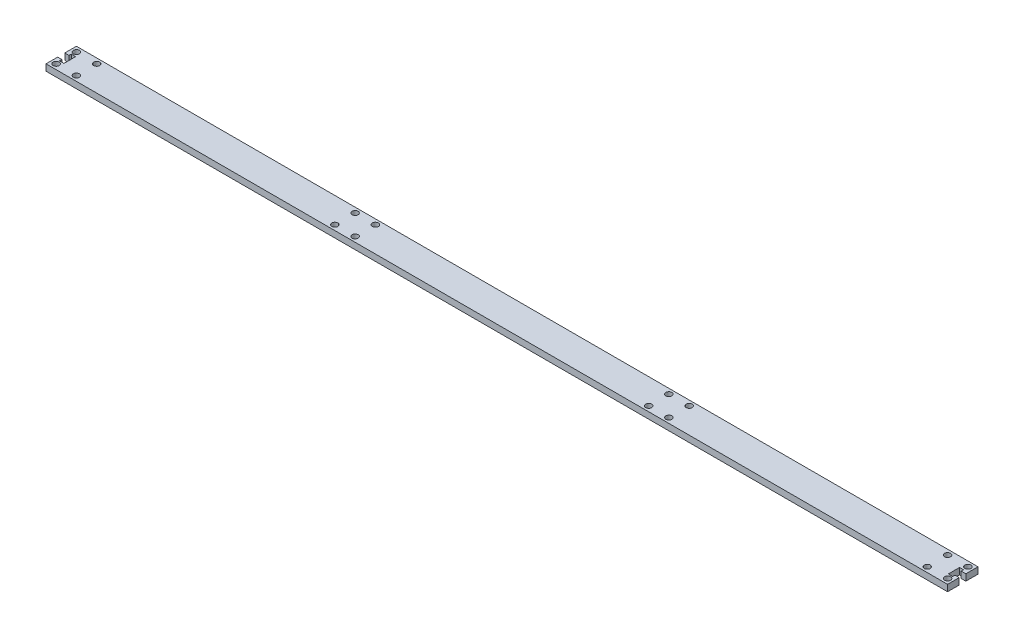
from build123d import *

# Parameters (mm, degrees)
SKETCH1_R           = 1.5
BOSS_EXTRUDE1_DEPTH = 3.175
CUT_EXTRUDE2_DEPTH  = 10
SKETCH6_W           = 2.65
SKETCH6_H           = 3.175
CUT_EXTRUDE3_DEPTH  = 0.25


with BuildPart() as part:
    # Sketch1 → Boss-Extrude1 (new body)
    with BuildSketch(Plane(origin=(0, 0, 0), x_dir=(1, 0, 0), z_dir=(0, 1, 0))):
        Polygon((0, 7.5), (0, 0), (444.5, 0), (444.5, 15), (0, 15), align=None)
        with Locations((2.5, 2.5)):
            Circle(SKETCH1_R, mode=Mode.SUBTRACT)
        with Locations((12.5, 2.5)):
            Circle(SKETCH1_R, mode=Mode.SUBTRACT)
        with Locations((2.5, 12.5)):
            Circle(SKETCH1_R, mode=Mode.SUBTRACT)
        with Locations((12.5, 12.5)):
            Circle(SKETCH1_R, mode=Mode.SUBTRACT)
        with Locations((139.9, 2.5)):
            Circle(SKETCH1_R, mode=Mode.SUBTRACT)
        with Locations((149.9, 2.5)):
            Circle(SKETCH1_R, mode=Mode.SUBTRACT)
        with Locations((139.9, 12.5)):
            Circle(SKETCH1_R, mode=Mode.SUBTRACT)
        with Locations((149.9, 12.5)):
            Circle(SKETCH1_R, mode=Mode.SUBTRACT)
        with Locations((442, 12.5)):
            Circle(SKETCH1_R, mode=Mode.SUBTRACT)
        with Locations((294.6, 2.5)):
            Circle(SKETCH1_R, mode=Mode.SUBTRACT)
        with Locations((304.6, 2.5)):
            Circle(SKETCH1_R, mode=Mode.SUBTRACT)
        with Locations((432, 2.5)):
            Circle(SKETCH1_R, mode=Mode.SUBTRACT)
        with Locations((442, 2.5)):
            Circle(SKETCH1_R, mode=Mode.SUBTRACT)
        with Locations((294.6, 12.5)):
            Circle(SKETCH1_R, mode=Mode.SUBTRACT)
        with Locations((304.6, 12.5)):
            Circle(SKETCH1_R, mode=Mode.SUBTRACT)
        with Locations((432, 12.5)):
            Circle(SKETCH1_R, mode=Mode.SUBTRACT)
    extrude(amount=BOSS_EXTRUDE1_DEPTH)

    # Sketch4 → Cut-Extrude2 (cut)
    with BuildSketch(Plane(origin=(0, 3.175, 0), x_dir=(1, 0, 0), z_dir=(0, 1, 0))):
        Polygon((444.5, 5.75), (444.5, 9), (442.2, 9), (442.2, 10.15), (440.5, 10.15), (440.5, 7.5), (440.25, 7.5), (440.25, 4.6), (442.45, 4.6), (442.45, 5.75), align=None)
        Polygon((2.05, 9.25), (0, 9.25), (0, 5.75), (2.05, 5.75), (2.05, 4.6), (4.25, 4.6), (4.25, 10.4), (2.05, 10.4), align=None)
    extrude(amount=-CUT_EXTRUDE2_DEPTH, mode=Mode.SUBTRACT)

    # Sketch6 → Cut-Extrude3 (cut)
    with BuildSketch(Plane(origin=(440.5, 0, 0), x_dir=(0, 0, -1), z_dir=(1, 0, 0))):
        with Locations((8.825, 1.5875)):
            Rectangle(SKETCH6_W, SKETCH6_H)
    extrude(amount=-CUT_EXTRUDE3_DEPTH, mode=Mode.SUBTRACT)


solid = part.part
